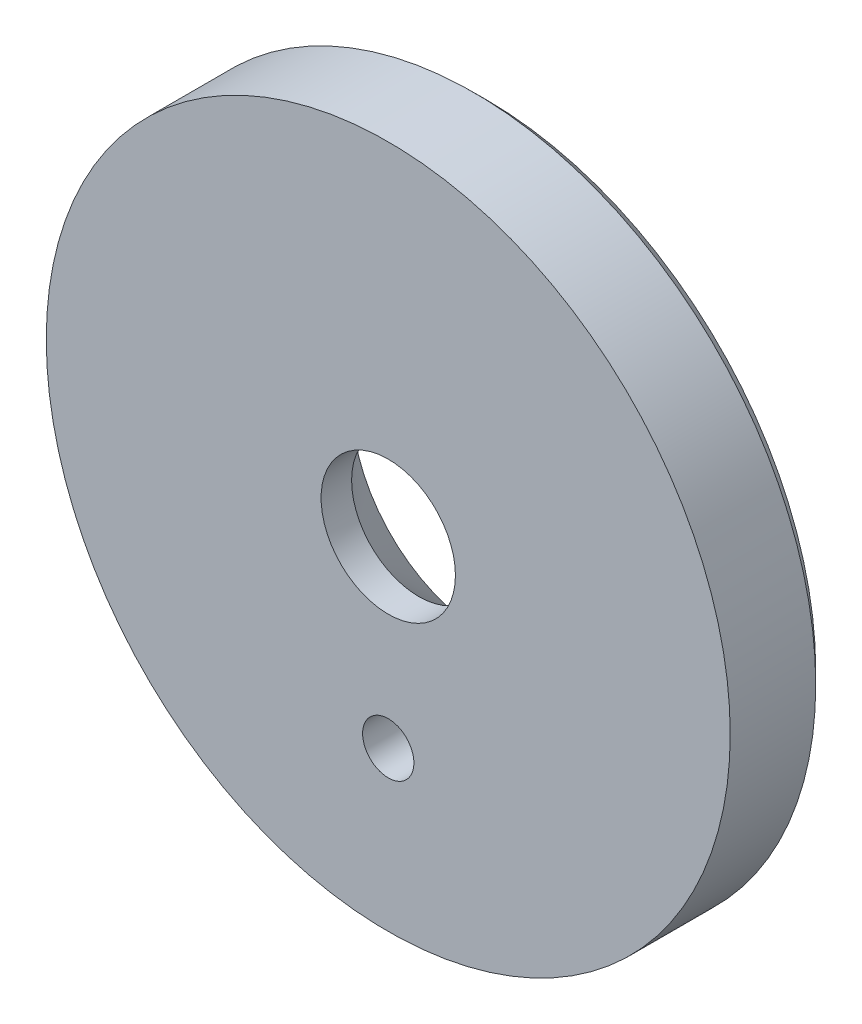
from build123d import *

# Parameters (mm, degrees)
SKETCH1_R          = 14
SKETCH1_R_2        = 2.75
BASE_EXTRUDE_DEPTH = 4
CHAMFER1_SIZE      = 0.5
SKETCH3_R          = 1.05
HOLE_EXSCIND_DEPTH = 37.301976475


with BuildPart() as part:
    # Sketch1 → Base-Extrude (new body)
    with BuildSketch(Plane.XY):
        Circle(SKETCH1_R)
        Circle(SKETCH1_R_2, mode=Mode.SUBTRACT)
    extrude(amount=-BASE_EXTRUDE_DEPTH)

    # Sketch2 → Cut-Revolve1 (revolve, cut)
    with BuildSketch(Plane(origin=(0, 0, 0), x_dir=(1, 0, 0), z_dir=(0, 1, 0))):
        Polygon((-5.5, 4), (-2.75, 4), (-2.75, 1.25), align=None)
    revolve(axis=Axis((0, 0, -8.465583771), (0, 0, 1)), mode=Mode.SUBTRACT)

    # Chamfer1
    chamfer1_edges = [part.edges().sort_by_distance(p)[0] for p in [
        (-14, 0, -4),
    ]]
    chamfer(chamfer1_edges, length=CHAMFER1_SIZE)

    # Sketch3 → Hole-Exscind (cut, through all)
    with BuildSketch(Plane(origin=(-5.32130403, -16.47163774, -4), x_dir=(-1, 0, 0), z_dir=(0, 0, -1))):
        with Locations((-5.32130403, 8.97163774)):
            Circle(SKETCH3_R)
    extrude(amount=-HOLE_EXSCIND_DEPTH, mode=Mode.SUBTRACT)


solid = part.part
